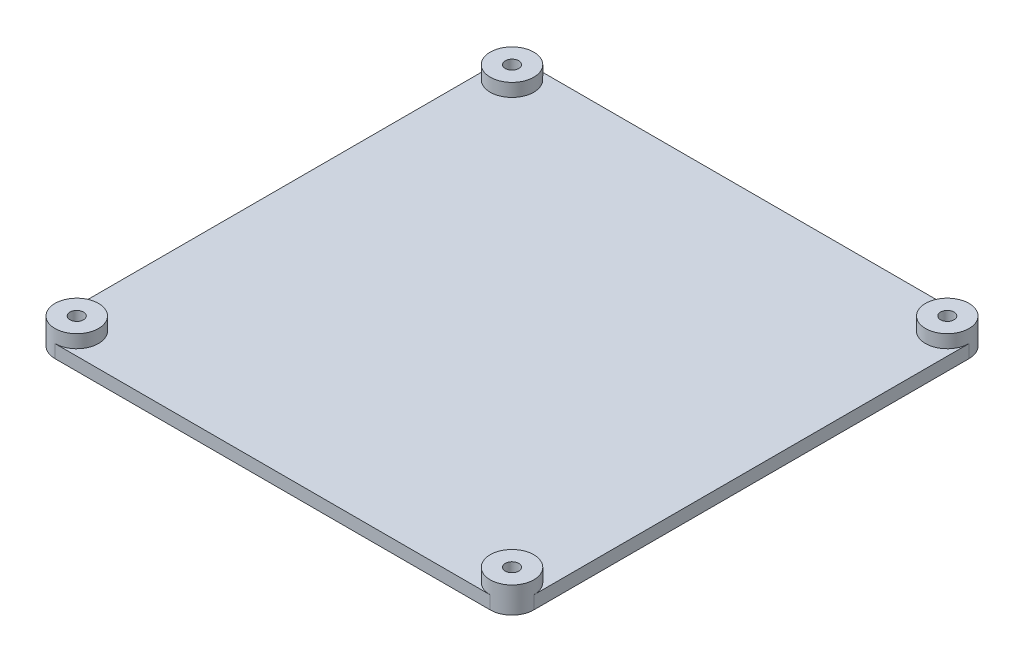
from build123d import *

# Parameters (mm, degrees)
BOSS_EXTRUDE1_DEPTH = 3
FILLET1_R           = 5
BOSS_EXTRUDE2_START = 3
SKETCH2_R           = 4.9999999999999964
SKETCH2_R_2         = 4.999999999999989
BOSS_EXTRUDE2_DEPTH = 3
SKETCH6_R           = 1.5500000000000018
CUT_EXTRUDE1_DEPTH  = 79.01281945936837


with BuildPart() as part:
    # Sketch1 → Boss-Extrude1 (new body)
    with BuildSketch(Plane(origin=(0, 0, 0), x_dir=(1, 0, 0), z_dir=(0, 1, 0))):
        Polygon((-55.00000000000002, 54.99999999999999), (54.99999999999998, 54.99999999999999), (54.99999999999999, -55.00000000000001), (-55.00000000000001, -55.00000000000001), align=None)
    extrude(amount=BOSS_EXTRUDE1_DEPTH)

    # Fillet1
    fillet1_edges = [part.edges().sort_by_distance(p)[0] for p in [
        (-55.00000000000002, 1.5, -54.99999999999999),
        (54.99999999999998, 1.5, -54.99999999999999),
        (54.99999999999999, 1.5, 55.00000000000001),
        (-55.00000000000001, 1.5, 55.00000000000001),
    ]]
    fillet(fillet1_edges, radius=FILLET1_R)

    # Sketch2 → Boss-Extrude2 (add)
    with BuildSketch(Plane(origin=(0, 3, 0), x_dir=(1, 0, 0), z_dir=(0, 1, 0)).offset(BOSS_EXTRUDE2_START)):
        with Locations((-50.00000000000002, 49.99999999999999)):
            Circle(SKETCH2_R)
        with Locations((49.999999999999986, 49.99999999999999)):
            Circle(SKETCH2_R)
        with Locations((49.99999999999999, -50.000000000000014)):
            Circle(SKETCH2_R_2)
        with Locations((-50.00000000000001, -50.00000000000001)):
            Circle(SKETCH2_R)
    extrude(amount=-BOSS_EXTRUDE2_DEPTH)

    # Sketch6 → Cut-Extrude1 (cut, through all)
    with BuildSketch(Plane.XZ):
        with Locations((-50.00000000000001, 50.00000000000001)):
            Circle(SKETCH6_R)
        with Locations((49.999999999999986, -49.99999999999999)):
            Circle(SKETCH6_R)
        with Locations((49.99999999999999, 50.000000000000014)):
            Circle(SKETCH6_R)
        with Locations((-50.00000000000002, -49.99999999999999)):
            Circle(SKETCH6_R)
    extrude(amount=-CUT_EXTRUDE1_DEPTH, mode=Mode.SUBTRACT)


solid = part.part
